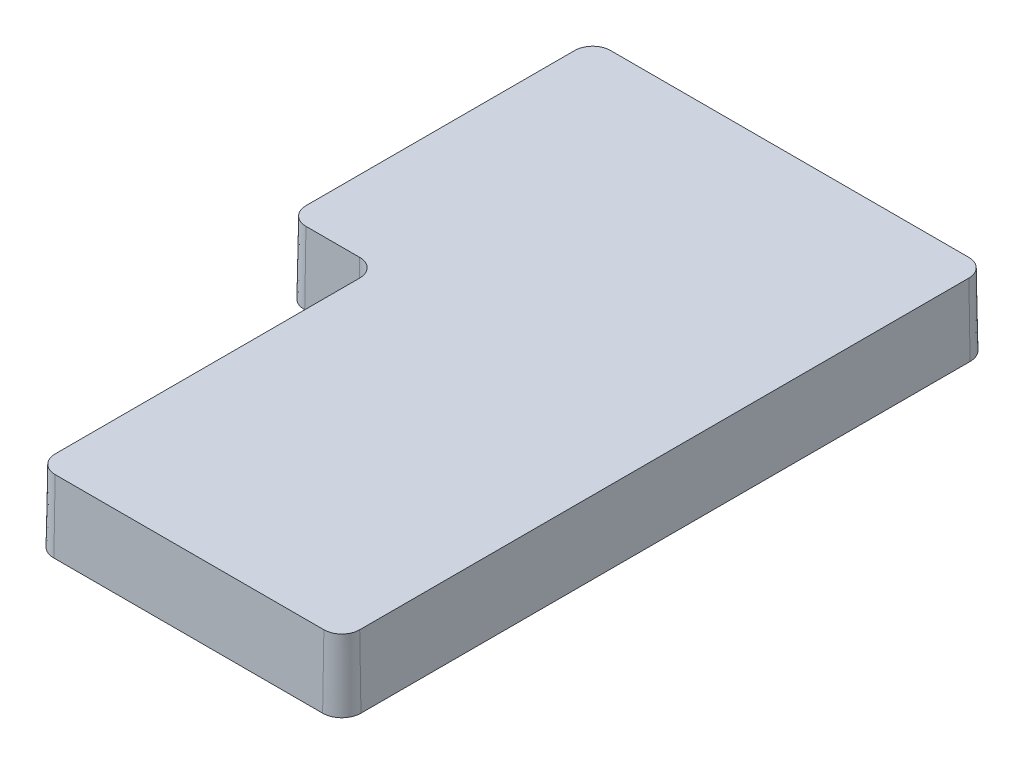
from build123d import *

# Parameters (mm, degrees)
BOSS_EXTRUDE1_DEPTH            = 4
BOSS_EXTRUDE1_DRAFT            = 1
SHELL1_T                       = -0.5
BOSS_EXTRUDE2_DEPTH            = 4
BOSS_EXTRUDE2_DRAFT            = 1.5
BOSS_EXTRUDE2_PROFILE_2_DEPTH  = 4
BOSS_EXTRUDE2_PROFILE_2_DRAFT  = 1.5
BOSS_EXTRUDE2_PROFILE_3_DEPTH  = 4
BOSS_EXTRUDE2_PROFILE_3_DRAFT  = 1.5
BOSS_EXTRUDE2_PROFILE_4_DEPTH  = 4
BOSS_EXTRUDE2_PROFILE_4_DRAFT  = 1.5
BOSS_EXTRUDE2_PROFILE_5_DEPTH  = 4
BOSS_EXTRUDE2_PROFILE_5_DRAFT  = 1.5
BOSS_EXTRUDE2_PROFILE_6_DEPTH  = 4
BOSS_EXTRUDE2_PROFILE_6_DRAFT  = 1.5
BOSS_EXTRUDE2_PROFILE_7_DEPTH  = 4
BOSS_EXTRUDE2_PROFILE_7_DRAFT  = 1.5
BOSS_EXTRUDE2_PROFILE_8_DEPTH  = 4
BOSS_EXTRUDE2_PROFILE_8_DRAFT  = 1.5
BOSS_EXTRUDE2_PROFILE_9_DEPTH  = 4
BOSS_EXTRUDE2_PROFILE_9_DRAFT  = 1.5
BOSS_EXTRUDE2_PROFILE_10_DEPTH = 4
BOSS_EXTRUDE2_PROFILE_10_DRAFT = 1.5
BOSS_EXTRUDE2_PROFILE_11_DEPTH = 4
BOSS_EXTRUDE2_PROFILE_11_DRAFT = 1.5
BOSS_EXTRUDE2_PROFILE_12_DEPTH = 4
BOSS_EXTRUDE2_PROFILE_12_DRAFT = 1.5
BOSS_EXTRUDE2_PROFILE_13_DEPTH = 4
BOSS_EXTRUDE2_PROFILE_13_DRAFT = 1.5
BOSS_EXTRUDE2_PROFILE_14_DEPTH = 4
BOSS_EXTRUDE2_PROFILE_14_DRAFT = 1.5
BOSS_EXTRUDE2_PROFILE_15_DEPTH = 4
BOSS_EXTRUDE2_PROFILE_15_DRAFT = 1.5
BOSS_EXTRUDE2_PROFILE_16_DEPTH = 4
BOSS_EXTRUDE2_PROFILE_16_DRAFT = 1.5


with BuildPart() as part:
    # Sketch1 → Boss-Extrude1 (with draft: the straight prism first)
    with BuildSketch(Plane(origin=(0, 0, 0), x_dir=(1, 0, 0), z_dir=(0, 1, 0))):
        with BuildLine():
            Line((9.307147932, 15.453623562), (-10.692852068, 15.453623562))
            ThreePointArc((-10.692852068, 15.453623562), (-11.399958849, 15.160730343), (-11.692852068, 14.453623562))
            Line((-11.692852068, 14.453623562), (-11.692852068, -0.546376438))
            ThreePointArc((-11.692852068, -0.546376438), (-11.399958849, -1.253483219), (-10.692852068, -1.546376438))
            Line((-10.692852068, -1.546376438), (-7.692852068, -1.546376438))
            ThreePointArc((-7.692852068, -1.546376438), (-6.985745287, -1.839269657), (-6.692852068, -2.546376438))
            Line((-6.692852068, -2.546376438), (-6.692852068, -19.546376438))
            ThreePointArc((-6.692852068, -19.546376438), (-6.399958849, -20.253483219), (-5.692852068, -20.546376438))
            Line((-5.692852068, -20.546376438), (9.307147932, -20.546376438))
            ThreePointArc((9.307147932, -20.546376438), (10.014254713, -20.253483219), (10.307147932, -19.546376438))
            Line((10.307147932, -19.546376438), (10.307147932, 14.453623562))
            ThreePointArc((10.307147932, 14.453623562), (10.014254713, 15.160730343), (9.307147932, 15.453623562))
        make_face()
    extrude(amount=-BOSS_EXTRUDE1_DEPTH)
    # Boss-Extrude1: the draft: its side faces are tilted about the plane it starts from
    boss_extrude1_sides = [part.faces().sort_by_distance(p)[0] for p in [
        (-0.692852068, -2, -15.453623562),
        (-11.399958849, -2, -15.160730343),
        (-11.692852068, -2, -6.953623562),
        (-11.399958849, -2, 1.253483219),
        (-9.192852068, -2, 1.546376438),
        (-6.985745287, -2, 1.839269657),
        (-6.692852068, -2, 11.046376438),
        (-6.399958849, -2, 20.253483219),
        (1.807147932, -2, 20.546376438),
        (10.014254713, -2, 20.253483219),
        (10.307147932, -2, 2.546376438),
        (10.014254713, -2, -15.160730343),
    ]]
    draft(boss_extrude1_sides, Plane(origin=(0, 0, 0), x_dir=(1, 0, 0), z_dir=(0, 1, 0)), BOSS_EXTRUDE1_DRAFT)

    # Shell1
    shell1_openings = [part.faces().sort_by_distance(p)[0] for p in [
        (0.463840033, -4, 1.39028021),
    ]]
    offset(amount=SHELL1_T, openings=shell1_openings, kind=Kind.INTERSECTION)


with BuildPart() as boss_extrude2_tool:
    # Sketch2 → Boss-Extrude2 (with draft: the straight prism first)
    with BuildSketch(Plane(origin=(0, -0.5, 0), x_dir=(-1, 0, 0), z_dir=(0, -1, 0))):
        with BuildLine():
            Line((5.662672328, 8.897221709), (3.323284636, 8.897221709))
            ThreePointArc((3.323284636, 8.897221709), (4.141351984, 7.375901365), (5.662672328, 6.557834018))
            Line((5.662672328, 6.557834018), (5.662672328, 8.897221709))
        make_face()
    extrude(amount=BOSS_EXTRUDE2_DEPTH)
    # Boss-Extrude2: the draft: its side faces are tilted about the plane it starts from
    boss_extrude2_sides = [boss_extrude2_tool.faces().sort_by_distance(p)[0] for p in [
        (-5.662672328, -2.5, -7.727527863),
        (-4.492978482, -2.5, -8.897221709),
        (-4.141351984, -2.5, -7.375901365),
    ]]
    draft(boss_extrude2_sides, Plane(origin=(0, -0.5, 0), x_dir=(-1, 0, 0), z_dir=(0, -1, 0)), BOSS_EXTRUDE2_DRAFT)


with BuildPart() as part_1:
    add(part.part)

    # Boss-Extrude2: add boss_extrude2_tool
    add(boss_extrude2_tool.part)


with BuildPart() as boss_extrude2_profile_2_tool:
    # Sketch2 → Boss-Extrude2 profile 2 (with draft: the straight prism first)
    with BuildSketch(Plane(origin=(0, -0.5, 0), x_dir=(-1, 0, 0), z_dir=(0, -1, 0))):
        with BuildLine():
            ThreePointArc((-5.476968192, 12.462831513), (-6.998288535, 11.644764166), (-7.816355883, 10.123443822))
            Line((-7.816355883, 10.123443822), (-5.476968192, 10.123443822))
            Line((-5.476968192, 10.123443822), (-5.476968192, 12.462831513))
        make_face()
    extrude(amount=BOSS_EXTRUDE2_PROFILE_2_DEPTH)
    # Boss-Extrude2 profile 2: the draft: its side faces are tilted about the plane it starts from
    boss_extrude2_profile_2_sides = [boss_extrude2_profile_2_tool.faces().sort_by_distance(p)[0] for p in [
        (6.998288535, -2.5, -11.644764166),
        (6.646662037, -2.5, -10.123443822),
        (5.476968192, -2.5, -11.293137668),
    ]]
    draft(boss_extrude2_profile_2_sides, Plane(origin=(0, -0.5, 0), x_dir=(-1, 0, 0), z_dir=(0, -1, 0)), BOSS_EXTRUDE2_PROFILE_2_DRAFT)


with BuildPart() as part_2:
    add(part_1.part)

    # Boss-Extrude2 profile 2: add boss_extrude2_profile_2_tool
    add(boss_extrude2_profile_2_tool.part)


with BuildPart() as boss_extrude2_profile_3_tool:
    # Sketch2 → Boss-Extrude2 profile 3 (with draft: the straight prism first)
    with BuildSketch(Plane(origin=(0, -0.5, 0), x_dir=(-1, 0, 0), z_dir=(0, -1, 0))):
        with BuildLine():
            ThreePointArc((-6.976968192, -11.676809006), (-8.498288535, -12.494876354), (-9.316355883, -14.016196697))
            Line((-9.316355883, -14.016196697), (-6.976968192, -14.016196697))
            Line((-6.976968192, -14.016196697), (-6.976968192, -11.676809006))
        make_face()
    extrude(amount=BOSS_EXTRUDE2_PROFILE_3_DEPTH)
    # Boss-Extrude2 profile 3: the draft: its side faces are tilted about the plane it starts from
    boss_extrude2_profile_3_sides = [boss_extrude2_profile_3_tool.faces().sort_by_distance(p)[0] for p in [
        (8.498288535, -2.5, 12.494876354),
        (8.146662037, -2.5, 14.016196697),
        (6.976968192, -2.5, 12.846502852),
    ]]
    draft(boss_extrude2_profile_3_sides, Plane(origin=(0, -0.5, 0), x_dir=(-1, 0, 0), z_dir=(0, -1, 0)), BOSS_EXTRUDE2_PROFILE_3_DRAFT)


with BuildPart() as part_3:
    add(part_2.part)

    # Boss-Extrude2 profile 3: add boss_extrude2_profile_3_tool
    add(boss_extrude2_profile_3_tool.part)


with BuildPart() as boss_extrude2_profile_4_tool:
    # Sketch2 → Boss-Extrude2 profile 4 (with draft: the straight prism first)
    with BuildSketch(Plane(origin=(0, -0.5, 0), x_dir=(-1, 0, 0), z_dir=(0, -1, 0))):
        with BuildLine():
            ThreePointArc((5.662672328, 12.4366094), (4.141351984, 11.618542053), (3.323284636, 10.097221709))
            Line((3.323284636, 10.097221709), (5.662672328, 10.097221709))
            Line((5.662672328, 10.097221709), (5.662672328, 12.4366094))
        make_face()
    extrude(amount=BOSS_EXTRUDE2_PROFILE_4_DEPTH)
    # Boss-Extrude2 profile 4: the draft: its side faces are tilted about the plane it starts from
    boss_extrude2_profile_4_sides = [boss_extrude2_profile_4_tool.faces().sort_by_distance(p)[0] for p in [
        (-4.141351984, -2.5, -11.618542053),
        (-4.492978482, -2.5, -10.097221709),
        (-5.662672328, -2.5, -11.266915555),
    ]]
    draft(boss_extrude2_profile_4_sides, Plane(origin=(0, -0.5, 0), x_dir=(-1, 0, 0), z_dir=(0, -1, 0)), BOSS_EXTRUDE2_PROFILE_4_DRAFT)


with BuildPart() as part_4:
    add(part_3.part)

    # Boss-Extrude2 profile 4: add boss_extrude2_profile_4_tool
    add(boss_extrude2_profile_4_tool.part)


with BuildPart() as boss_extrude2_profile_5_tool:
    # Sketch2 → Boss-Extrude2 profile 5 (with draft: the straight prism first)
    with BuildSketch(Plane(origin=(0, -0.5, 0), x_dir=(-1, 0, 0), z_dir=(0, -1, 0))):
        with BuildLine():
            ThreePointArc((2.162672328, -11.676809006), (0.641351984, -12.494876354), (-0.176715364, -14.016196697))
            Line((-0.176715364, -14.016196697), (2.162672328, -14.016196697))
            Line((2.162672328, -14.016196697), (2.162672328, -11.676809006))
        make_face()
    extrude(amount=BOSS_EXTRUDE2_PROFILE_5_DEPTH)
    # Boss-Extrude2 profile 5: the draft: its side faces are tilted about the plane it starts from
    boss_extrude2_profile_5_sides = [boss_extrude2_profile_5_tool.faces().sort_by_distance(p)[0] for p in [
        (-0.641351984, -2.5, 12.494876354),
        (-0.992978482, -2.5, 14.016196697),
        (-2.162672328, -2.5, 12.846502852),
    ]]
    draft(boss_extrude2_profile_5_sides, Plane(origin=(0, -0.5, 0), x_dir=(-1, 0, 0), z_dir=(0, -1, 0)), BOSS_EXTRUDE2_PROFILE_5_DRAFT)


with BuildPart() as part_5:
    add(part_4.part)

    # Boss-Extrude2 profile 5: add boss_extrude2_profile_5_tool
    add(boss_extrude2_profile_5_tool.part)


with BuildPart() as boss_extrude2_profile_6_tool:
    # Sketch2 → Boss-Extrude2 profile 6 (with draft: the straight prism first)
    with BuildSketch(Plane(origin=(0, -0.5, 0), x_dir=(-1, 0, 0), z_dir=(0, -1, 0))):
        with BuildLine():
            Line((-4.276968192, 12.462831513), (-4.276968192, 10.123443822))
            Line((-4.276968192, 10.123443822), (-1.9375805, 10.123443822))
            ThreePointArc((-1.9375805, 10.123443822), (-2.755647848, 11.644764166), (-4.276968192, 12.462831513))
        make_face()
    extrude(amount=BOSS_EXTRUDE2_PROFILE_6_DEPTH)
    # Boss-Extrude2 profile 6: the draft: its side faces are tilted about the plane it starts from
    boss_extrude2_profile_6_sides = [boss_extrude2_profile_6_tool.faces().sort_by_distance(p)[0] for p in [
        (2.755647848, -2.5, -11.644764166),
        (4.276968192, -2.5, -11.293137668),
        (3.107274346, -2.5, -10.123443822),
    ]]
    draft(boss_extrude2_profile_6_sides, Plane(origin=(0, -0.5, 0), x_dir=(-1, 0, 0), z_dir=(0, -1, 0)), BOSS_EXTRUDE2_PROFILE_6_DRAFT)


with BuildPart() as part_6:
    add(part_5.part)

    # Boss-Extrude2 profile 6: add boss_extrude2_profile_6_tool
    add(boss_extrude2_profile_6_tool.part)


with BuildPart() as boss_extrude2_profile_7_tool:
    # Sketch2 → Boss-Extrude2 profile 7 (with draft: the straight prism first)
    with BuildSketch(Plane(origin=(0, -0.5, 0), x_dir=(-1, 0, 0), z_dir=(0, -1, 0))):
        with BuildLine():
            Line((6.862672328, 12.4366094), (6.862672328, 10.097221709))
            Line((6.862672328, 10.097221709), (9.202060019, 10.097221709))
            ThreePointArc((9.202060019, 10.097221709), (8.383992671, 11.618542053), (6.862672328, 12.4366094))
        make_face()
    extrude(amount=BOSS_EXTRUDE2_PROFILE_7_DEPTH)
    # Boss-Extrude2 profile 7: the draft: its side faces are tilted about the plane it starts from
    boss_extrude2_profile_7_sides = [boss_extrude2_profile_7_tool.faces().sort_by_distance(p)[0] for p in [
        (-6.862672328, -2.5, -11.266915555),
        (-8.032366173, -2.5, -10.097221709),
        (-8.383992671, -2.5, -11.618542053),
    ]]
    draft(boss_extrude2_profile_7_sides, Plane(origin=(0, -0.5, 0), x_dir=(-1, 0, 0), z_dir=(0, -1, 0)), BOSS_EXTRUDE2_PROFILE_7_DRAFT)


with BuildPart() as part_7:
    add(part_6.part)

    # Boss-Extrude2 profile 7: add boss_extrude2_profile_7_tool
    add(boss_extrude2_profile_7_tool.part)


with BuildPart() as boss_extrude2_profile_8_tool:
    # Sketch2 → Boss-Extrude2 profile 8 (with draft: the straight prism first)
    with BuildSketch(Plane(origin=(0, -0.5, 0), x_dir=(-1, 0, 0), z_dir=(0, -1, 0))):
        with BuildLine():
            Line((-5.776968192, -11.676809006), (-5.776968192, -14.016196697))
            Line((-5.776968192, -14.016196697), (-3.4375805, -14.016196697))
            ThreePointArc((-3.4375805, -14.016196697), (-4.255647848, -12.494876354), (-5.776968192, -11.676809006))
        make_face()
    extrude(amount=BOSS_EXTRUDE2_PROFILE_8_DEPTH)
    # Boss-Extrude2 profile 8: the draft: its side faces are tilted about the plane it starts from
    boss_extrude2_profile_8_sides = [boss_extrude2_profile_8_tool.faces().sort_by_distance(p)[0] for p in [
        (4.255647848, -2.5, 12.494876354),
        (5.776968192, -2.5, 12.846502852),
        (4.607274346, -2.5, 14.016196697),
    ]]
    draft(boss_extrude2_profile_8_sides, Plane(origin=(0, -0.5, 0), x_dir=(-1, 0, 0), z_dir=(0, -1, 0)), BOSS_EXTRUDE2_PROFILE_8_DRAFT)


with BuildPart() as part_8:
    add(part_7.part)

    # Boss-Extrude2 profile 8: add boss_extrude2_profile_8_tool
    add(boss_extrude2_profile_8_tool.part)


with BuildPart() as boss_extrude2_profile_9_tool:
    # Sketch2 → Boss-Extrude2 profile 9 (with draft: the straight prism first)
    with BuildSketch(Plane(origin=(0, -0.5, 0), x_dir=(-1, 0, 0), z_dir=(0, -1, 0))):
        with BuildLine():
            Line((3.362672328, -11.676809006), (3.362672328, -14.016196697))
            Line((3.362672328, -14.016196697), (5.702060019, -14.016196697))
            ThreePointArc((5.702060019, -14.016196697), (4.883992671, -12.494876354), (3.362672328, -11.676809006))
        make_face()
    extrude(amount=BOSS_EXTRUDE2_PROFILE_9_DEPTH)
    # Boss-Extrude2 profile 9: the draft: its side faces are tilted about the plane it starts from
    boss_extrude2_profile_9_sides = [boss_extrude2_profile_9_tool.faces().sort_by_distance(p)[0] for p in [
        (-3.362672328, -2.5, 12.846502852),
        (-4.532366173, -2.5, 14.016196697),
        (-4.883992671, -2.5, 12.494876354),
    ]]
    draft(boss_extrude2_profile_9_sides, Plane(origin=(0, -0.5, 0), x_dir=(-1, 0, 0), z_dir=(0, -1, 0)), BOSS_EXTRUDE2_PROFILE_9_DRAFT)


with BuildPart() as part_9:
    add(part_8.part)

    # Boss-Extrude2 profile 9: add boss_extrude2_profile_9_tool
    add(boss_extrude2_profile_9_tool.part)


with BuildPart() as boss_extrude2_profile_10_tool:
    # Sketch2 → Boss-Extrude2 profile 10 (with draft: the straight prism first)
    with BuildSketch(Plane(origin=(0, -0.5, 0), x_dir=(-1, 0, 0), z_dir=(0, -1, 0))):
        with BuildLine():
            ThreePointArc((-9.316355883, -15.216196697), (-8.498288535, -16.737517041), (-6.976968192, -17.555584389))
            Line((-6.976968192, -17.555584389), (-6.976968192, -15.216196697))
            Line((-6.976968192, -15.216196697), (-9.316355883, -15.216196697))
        make_face()
    extrude(amount=BOSS_EXTRUDE2_PROFILE_10_DEPTH)
    # Boss-Extrude2 profile 10: the draft: its side faces are tilted about the plane it starts from
    boss_extrude2_profile_10_sides = [boss_extrude2_profile_10_tool.faces().sort_by_distance(p)[0] for p in [
        (8.498288535, -2.5, 16.737517041),
        (6.976968192, -2.5, 16.385890543),
        (8.146662037, -2.5, 15.216196697),
    ]]
    draft(boss_extrude2_profile_10_sides, Plane(origin=(0, -0.5, 0), x_dir=(-1, 0, 0), z_dir=(0, -1, 0)), BOSS_EXTRUDE2_PROFILE_10_DRAFT)


with BuildPart() as part_10:
    add(part_9.part)

    # Boss-Extrude2 profile 10: add boss_extrude2_profile_10_tool
    add(boss_extrude2_profile_10_tool.part)


with BuildPart() as boss_extrude2_profile_11_tool:
    # Sketch2 → Boss-Extrude2 profile 11 (with draft: the straight prism first)
    with BuildSketch(Plane(origin=(0, -0.5, 0), x_dir=(-1, 0, 0), z_dir=(0, -1, 0))):
        with BuildLine():
            ThreePointArc((-0.176715364, -15.216196697), (0.641351984, -16.737517041), (2.162672328, -17.555584389))
            Line((2.162672328, -17.555584389), (2.162672328, -15.216196697))
            Line((2.162672328, -15.216196697), (-0.176715364, -15.216196697))
        make_face()
    extrude(amount=BOSS_EXTRUDE2_PROFILE_11_DEPTH)
    # Boss-Extrude2 profile 11: the draft: its side faces are tilted about the plane it starts from
    boss_extrude2_profile_11_sides = [boss_extrude2_profile_11_tool.faces().sort_by_distance(p)[0] for p in [
        (-0.641351984, -2.5, 16.737517041),
        (-2.162672328, -2.5, 16.385890543),
        (-0.992978482, -2.5, 15.216196697),
    ]]
    draft(boss_extrude2_profile_11_sides, Plane(origin=(0, -0.5, 0), x_dir=(-1, 0, 0), z_dir=(0, -1, 0)), BOSS_EXTRUDE2_PROFILE_11_DRAFT)


with BuildPart() as part_11:
    add(part_10.part)

    # Boss-Extrude2 profile 11: add boss_extrude2_profile_11_tool
    add(boss_extrude2_profile_11_tool.part)


with BuildPart() as boss_extrude2_profile_12_tool:
    # Sketch2 → Boss-Extrude2 profile 12 (with draft: the straight prism first)
    with BuildSketch(Plane(origin=(0, -0.5, 0), x_dir=(-1, 0, 0), z_dir=(0, -1, 0))):
        with BuildLine():
            Line((-5.776968192, -15.216196697), (-5.776968192, -17.555584389))
            ThreePointArc((-5.776968192, -17.555584389), (-4.255647848, -16.737517041), (-3.4375805, -15.216196697))
            Line((-3.4375805, -15.216196697), (-5.776968192, -15.216196697))
        make_face()
    extrude(amount=BOSS_EXTRUDE2_PROFILE_12_DEPTH)
    # Boss-Extrude2 profile 12: the draft: its side faces are tilted about the plane it starts from
    boss_extrude2_profile_12_sides = [boss_extrude2_profile_12_tool.faces().sort_by_distance(p)[0] for p in [
        (5.776968192, -2.5, 16.385890543),
        (4.255647848, -2.5, 16.737517041),
        (4.607274346, -2.5, 15.216196697),
    ]]
    draft(boss_extrude2_profile_12_sides, Plane(origin=(0, -0.5, 0), x_dir=(-1, 0, 0), z_dir=(0, -1, 0)), BOSS_EXTRUDE2_PROFILE_12_DRAFT)


with BuildPart() as part_12:
    add(part_11.part)

    # Boss-Extrude2 profile 12: add boss_extrude2_profile_12_tool
    add(boss_extrude2_profile_12_tool.part)


with BuildPart() as boss_extrude2_profile_13_tool:
    # Sketch2 → Boss-Extrude2 profile 13 (with draft: the straight prism first)
    with BuildSketch(Plane(origin=(0, -0.5, 0), x_dir=(-1, 0, 0), z_dir=(0, -1, 0))):
        with BuildLine():
            Line((3.362672328, -15.216196697), (3.362672328, -17.555584389))
            ThreePointArc((3.362672328, -17.555584389), (4.883992671, -16.737517041), (5.702060019, -15.216196697))
            Line((5.702060019, -15.216196697), (3.362672328, -15.216196697))
        make_face()
    extrude(amount=BOSS_EXTRUDE2_PROFILE_13_DEPTH)
    # Boss-Extrude2 profile 13: the draft: its side faces are tilted about the plane it starts from
    boss_extrude2_profile_13_sides = [boss_extrude2_profile_13_tool.faces().sort_by_distance(p)[0] for p in [
        (-3.362672328, -2.5, 16.385890543),
        (-4.883992671, -2.5, 16.737517041),
        (-4.532366173, -2.5, 15.216196697),
    ]]
    draft(boss_extrude2_profile_13_sides, Plane(origin=(0, -0.5, 0), x_dir=(-1, 0, 0), z_dir=(0, -1, 0)), BOSS_EXTRUDE2_PROFILE_13_DRAFT)


with BuildPart() as part_13:
    add(part_12.part)

    # Boss-Extrude2 profile 13: add boss_extrude2_profile_13_tool
    add(boss_extrude2_profile_13_tool.part)


with BuildPart() as boss_extrude2_profile_14_tool:
    # Sketch2 → Boss-Extrude2 profile 14 (with draft: the straight prism first)
    with BuildSketch(Plane(origin=(0, -0.5, 0), x_dir=(-1, 0, 0), z_dir=(0, -1, 0))):
        with BuildLine():
            ThreePointArc((-7.816355883, 8.923443822), (-6.998288535, 7.402123478), (-5.476968192, 6.584056131))
            Line((-5.476968192, 6.584056131), (-5.476968192, 8.923443822))
            Line((-5.476968192, 8.923443822), (-7.816355883, 8.923443822))
        make_face()
    extrude(amount=BOSS_EXTRUDE2_PROFILE_14_DEPTH)
    # Boss-Extrude2 profile 14: the draft: its side faces are tilted about the plane it starts from
    boss_extrude2_profile_14_sides = [boss_extrude2_profile_14_tool.faces().sort_by_distance(p)[0] for p in [
        (6.998288535, -2.5, -7.402123478),
        (5.476968192, -2.5, -7.753749976),
        (6.646662037, -2.5, -8.923443822),
    ]]
    draft(boss_extrude2_profile_14_sides, Plane(origin=(0, -0.5, 0), x_dir=(-1, 0, 0), z_dir=(0, -1, 0)), BOSS_EXTRUDE2_PROFILE_14_DRAFT)


with BuildPart() as part_14:
    add(part_13.part)

    # Boss-Extrude2 profile 14: add boss_extrude2_profile_14_tool
    add(boss_extrude2_profile_14_tool.part)


with BuildPart() as boss_extrude2_profile_15_tool:
    # Sketch2 → Boss-Extrude2 profile 15 (with draft: the straight prism first)
    with BuildSketch(Plane(origin=(0, -0.5, 0), x_dir=(-1, 0, 0), z_dir=(0, -1, 0))):
        with BuildLine():
            Line((-4.276968192, 8.923443822), (-4.276968192, 6.584056131))
            ThreePointArc((-4.276968192, 6.584056131), (-2.755647848, 7.402123478), (-1.9375805, 8.923443822))
            Line((-1.9375805, 8.923443822), (-4.276968192, 8.923443822))
        make_face()
    extrude(amount=BOSS_EXTRUDE2_PROFILE_15_DEPTH)
    # Boss-Extrude2 profile 15: the draft: its side faces are tilted about the plane it starts from
    boss_extrude2_profile_15_sides = [boss_extrude2_profile_15_tool.faces().sort_by_distance(p)[0] for p in [
        (3.107274346, -2.5, -8.923443822),
        (4.276968192, -2.5, -7.753749976),
        (2.755647848, -2.5, -7.402123478),
    ]]
    draft(boss_extrude2_profile_15_sides, Plane(origin=(0, -0.5, 0), x_dir=(-1, 0, 0), z_dir=(0, -1, 0)), BOSS_EXTRUDE2_PROFILE_15_DRAFT)


with BuildPart() as part_15:
    add(part_14.part)

    # Boss-Extrude2 profile 15: add boss_extrude2_profile_15_tool
    add(boss_extrude2_profile_15_tool.part)


with BuildPart() as boss_extrude2_profile_16_tool:
    # Sketch2 → Boss-Extrude2 profile 16 (with draft: the straight prism first)
    with BuildSketch(Plane(origin=(0, -0.5, 0), x_dir=(-1, 0, 0), z_dir=(0, -1, 0))):
        with BuildLine():
            Line((6.862672328, 8.897221709), (6.862672328, 6.557834018))
            ThreePointArc((6.862672328, 6.557834018), (8.383992671, 7.375901365), (9.202060019, 8.897221709))
            Line((9.202060019, 8.897221709), (6.862672328, 8.897221709))
        make_face()
    extrude(amount=BOSS_EXTRUDE2_PROFILE_16_DEPTH)
    # Boss-Extrude2 profile 16: the draft: its side faces are tilted about the plane it starts from
    boss_extrude2_profile_16_sides = [boss_extrude2_profile_16_tool.faces().sort_by_distance(p)[0] for p in [
        (-6.862672328, -2.5, -7.727527863),
        (-8.383992671, -2.5, -7.375901365),
        (-8.032366173, -2.5, -8.897221709),
    ]]
    draft(boss_extrude2_profile_16_sides, Plane(origin=(0, -0.5, 0), x_dir=(-1, 0, 0), z_dir=(0, -1, 0)), BOSS_EXTRUDE2_PROFILE_16_DRAFT)


with BuildPart() as part_16:
    add(part_15.part)

    # Boss-Extrude2 profile 16: add boss_extrude2_profile_16_tool
    add(boss_extrude2_profile_16_tool.part)


solid = part_16.part
